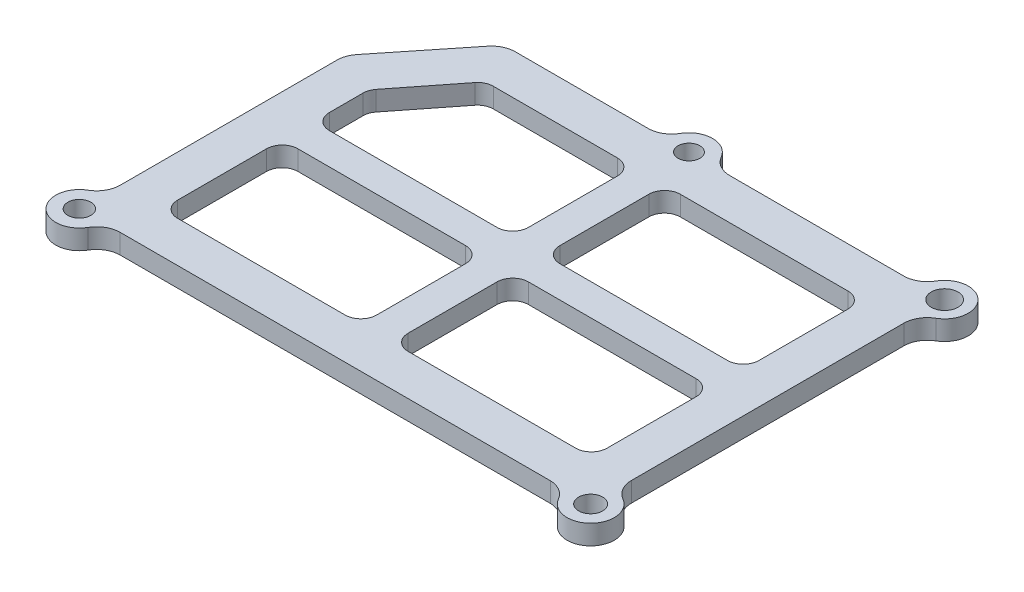
from build123d import *

# Parameters (mm, degrees)
SKETCH1_R           = 1.460547367
SKETCH1_R_2         = 1.529506536
SKETCH1_R_3         = 1.697609236
SKETCH1_R_4         = 1.387841656
BOSS_EXTRUDE1_DEPTH = 2.5


with BuildPart() as part:
    # Sketch1 → Boss-Extrude1 (new body)
    with BuildSketch(Plane(origin=(0, 0, 0), x_dir=(1, 0, 0), z_dir=(0, 1, 0))):
        with BuildLine():
            Line((-59.803847577, -22.5), (-5.103154719, -22.5))
            ThreePointArc((-5.103154719, -22.5), (-3.655814903, -22.924672865), (-2.598076211, -24))
            ThreePointArc((-2.598076211, -24), (2.121320344, -24.621320344), (1.5, -19.901923789))
            ThreePointArc((1.5, -19.901923789), (0.401923789, -18.803847577), (0, -17.303847577))
            Line((0, -17.303847577), (0, 17.303847577))
            ThreePointArc((0, 17.303847577), (0.401923789, 18.803847577), (1.5, 19.901923789))
            ThreePointArc((1.5, 19.901923789), (2.121320344, 24.621320344), (-2.598076211, 24))
            ThreePointArc((-2.598076211, 24), (-3.696152423, 22.901923789), (-5.196152423, 22.5))
            Line((-5.196152423, 22.5), (-27.303847577, 22.5))
            ThreePointArc((-27.303847577, 22.5), (-28.803847577, 22.901923789), (-29.901923789, 24))
            ThreePointArc((-29.901923789, 24), (-32.5, 25.5), (-35.098076211, 24))
            ThreePointArc((-35.098076211, 24), (-36.196152423, 22.901923789), (-37.696152423, 22.5))
            Line((-37.696152423, 22.5), (-54.594092955, 22.5))
            ThreePointArc((-54.594092955, 22.5), (-55.893348239, 22.204059117), (-56.936268352, 21.374623805))
            Line((-56.936268352, 21.374623805), (-64.342175397, 12.12160289))
            ThreePointArc((-64.342175397, 12.12160289), (-64.83077076, 11.240325402), (-65, 10.246979086))
            Line((-65, 10.246979086), (-65, -17.303847577))
            ThreePointArc((-65, -17.303847577), (-65.401923789, -18.803847577), (-66.5, -19.901923789))
            ThreePointArc((-66.5, -19.901923789), (-67.121320344, -24.621320344), (-62.401923789, -24))
            ThreePointArc((-62.401923789, -24), (-61.303847577, -22.901923789), (-59.803847577, -22.5))
        make_face()
        with Locations((-65, -22.5)):
            Circle(SKETCH1_R, mode=Mode.SUBTRACT)
        with Locations((0, -22.5)):
            Circle(SKETCH1_R_2, mode=Mode.SUBTRACT)
        with Locations((0, 22.5)):
            Circle(SKETCH1_R_3, mode=Mode.SUBTRACT)
        with Locations((-32.5, 22.5)):
            Circle(SKETCH1_R_4, mode=Mode.SUBTRACT)
        with BuildLine():
            Line((-59.282755774, 9.51895157), (-53.759170778, 16.540420196))
            ThreePointArc((-53.759170778, 16.540420196), (-53.061008193, 17.102895275), (-52.187264878, 17.303847577))
            Line((-52.187264878, 17.303847577), (-36.407002296, 17.303847577))
            ThreePointArc((-36.407002296, 17.303847577), (-34.992788734, 16.71806114), (-34.407002296, 15.303847577))
            Line((-34.407002296, 15.303847577), (-34.407002296, 4))
            ThreePointArc((-34.407002296, 4), (-34.992788734, 2.585786438), (-36.407002296, 2))
            Line((-36.407002296, 2), (-57.710849874, 2))
            ThreePointArc((-57.710849874, 2), (-59.125063436, 2.585786438), (-59.710849874, 4))
            Line((-59.710849874, 4), (-59.710849874, 8.282378951))
            ThreePointArc((-59.710849874, 8.282378951), (-59.600798524, 8.936667955), (-59.282755774, 9.51895157))
        make_face(mode=Mode.SUBTRACT)
        with BuildLine():
            Line((-57.710849874, -17.303847577), (-36.407002296, -17.303847577))
            ThreePointArc((-36.407002296, -17.303847577), (-34.992788734, -16.71806114), (-34.407002296, -15.303847577))
            Line((-34.407002296, -15.303847577), (-34.407002296, -4))
            ThreePointArc((-34.407002296, -4), (-34.992788734, -2.585786438), (-36.407002296, -2))
            Line((-36.407002296, -2), (-57.710849874, -2))
            ThreePointArc((-57.710849874, -2), (-59.125063436, -2.585786438), (-59.710849874, -4))
            Line((-59.710849874, -4), (-59.710849874, -15.303847577))
            ThreePointArc((-59.710849874, -15.303847577), (-59.125063436, -16.71806114), (-57.710849874, -17.303847577))
        make_face(mode=Mode.SUBTRACT)
        with BuildLine():
            Line((-5.103154719, -15.303847577), (-5.103154719, -4))
            ThreePointArc((-5.103154719, -4), (-5.688941157, -2.585786438), (-7.103154719, -2))
            Line((-7.103154719, -2), (-28.407002296, -2))
            ThreePointArc((-28.407002296, -2), (-29.821215859, -2.585786438), (-30.407002296, -4))
            Line((-30.407002296, -4), (-30.407002296, -15.303847577))
            ThreePointArc((-30.407002296, -15.303847577), (-29.821215859, -16.71806114), (-28.407002296, -17.303847577))
            Line((-28.407002296, -17.303847577), (-7.103154719, -17.303847577))
            ThreePointArc((-7.103154719, -17.303847577), (-5.688941157, -16.71806114), (-5.103154719, -15.303847577))
        make_face(mode=Mode.SUBTRACT)
        with BuildLine():
            Line((-28.407002296, 17.303847577), (-7.103154719, 17.303847577))
            ThreePointArc((-7.103154719, 17.303847577), (-5.688941157, 16.71806114), (-5.103154719, 15.303847577))
            Line((-5.103154719, 15.303847577), (-5.103154719, 4))
            ThreePointArc((-5.103154719, 4), (-5.688941157, 2.585786438), (-7.103154719, 2))
            Line((-7.103154719, 2), (-28.407002296, 2))
            ThreePointArc((-28.407002296, 2), (-29.821215859, 2.585786438), (-30.407002296, 4))
            Line((-30.407002296, 4), (-30.407002296, 15.303847577))
            ThreePointArc((-30.407002296, 15.303847577), (-29.821215859, 16.71806114), (-28.407002296, 17.303847577))
        make_face(mode=Mode.SUBTRACT)
    extrude(amount=BOSS_EXTRUDE1_DEPTH)


solid = part.part
